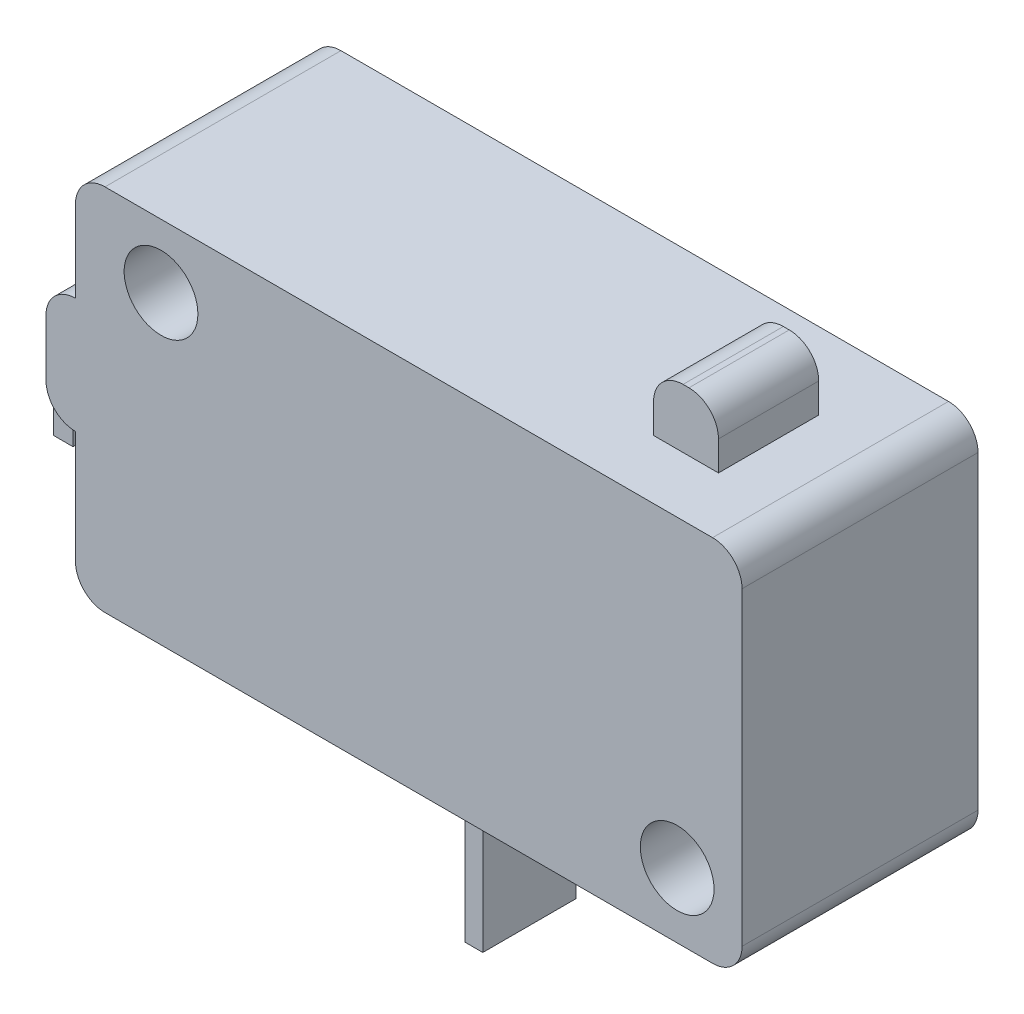
from build123d import *

# Parameters (mm, degrees)
SKETCH1_W           = 28.702
SKETCH1_H           = 15.875
BOSS_EXTRUDE1_DEPTH = 10.16
SKETCH2_R           = 1.5875
CUT_EXTRUDE1_DEPTH  = 12.4206
SKETCH4_W           = 0.763653933
SKETCH4_H           = 4.021910712
BOSS_EXTRUDE2_DEPTH = 6.35
SKETCH5_W           = 4.11779101
SKETCH5_H           = 0.870547728
BOSS_EXTRUDE3_DEPTH = 3.048
SKETCH6_W           = 0.83333033
SKETCH6_H           = 4.11779101
BOSS_EXTRUDE4_DEPTH = 3.048
FILLET1_R           = 0.508
SKETCH7_W           = 10.16
SKETCH7_H           = 4.966371196
BOSS_EXTRUDE5_DEPTH = 1.27
SKETCH8_W           = 2.794
SKETCH8_H           = 4.318
BOSS_EXTRUDE6_DEPTH = 2.54
FILLET3_R           = 1.27
FILLET5_R           = 1.27
FILLET6_R           = 1.27


with BuildPart() as part:
    # Sketch1 → Boss-Extrude1 (new body)
    with BuildSketch(Plane.XY):
        with Locations((14.351, 7.9375)):
            Rectangle(SKETCH1_W, SKETCH1_H)
    extrude(amount=BOSS_EXTRUDE1_DEPTH)

    # Sketch2 → Cut-Extrude1 (cut)
    with BuildSketch(Plane.XY.offset(10.16)):
        with Locations((3.683, 13.1318)):
            Circle(SKETCH2_R)
        with Locations((25.908, 2.794)):
            Circle(SKETCH2_R)
    extrude(amount=-CUT_EXTRUDE1_DEPTH, mode=Mode.SUBTRACT)

    # Sketch4 → Boss-Extrude2 (add)
    with BuildSketch(Plane(origin=(0, 0, 0), x_dir=(-1, 0, 0), z_dir=(0, -1, 0))):
        with Locations((-15.348638273, -6.340278275)):
            Rectangle(SKETCH4_W, SKETCH4_H)
    extrude(amount=BOSS_EXTRUDE2_DEPTH)

    # Sketch5 → Boss-Extrude3 (add)
    with BuildSketch(Plane.ZY):
        with Locations((5.992449892, 6.871421324)):
            Rectangle(SKETCH5_W, SKETCH5_H)
    extrude(amount=BOSS_EXTRUDE3_DEPTH)

    # Sketch6 → Boss-Extrude4 (add)
    with BuildSketch(Plane(origin=(0, 6.43614746, 0), x_dir=(-1, 0, 0), z_dir=(0, -1, 0))):
        with Locations((2.631334835, -5.992449892)):
            Rectangle(SKETCH6_W, SKETCH6_H)
    extrude(amount=BOSS_EXTRUDE4_DEPTH)

    # Fillet1
    fillet1_edges = [part.edges().sort_by_distance(p)[0] for p in [
        (-3.048, 7.306695188, 5.992449892),
    ]]
    fillet(fillet1_edges, radius=FILLET1_R)

    # Sketch7 → Boss-Extrude5 (add)
    with BuildSketch(Plane.ZY):
        with Locations((5.08, 8.603517934)):
            Rectangle(SKETCH7_W, SKETCH7_H)
    extrude(amount=BOSS_EXTRUDE5_DEPTH)

    # Sketch8 → Boss-Extrude6 (add)
    with BuildSketch(Plane(origin=(0, 15.875, 0), x_dir=(1, 0, 0), z_dir=(0, 1, 0))):
        with Locations((23.749, -5.461)):
            Rectangle(SKETCH8_W, SKETCH8_H)
    extrude(amount=BOSS_EXTRUDE6_DEPTH)

    # Fillet3
    fillet3_edges = [part.edges().sort_by_distance(p)[0] for p in [
        (22.352, 18.415, 5.461),
        (25.146, 18.415, 5.461),
    ]]
    fillet(fillet3_edges, radius=FILLET3_R)

    # Fillet5
    fillet5_edges = [part.edges().sort_by_distance(p)[0] for p in [
        (0, 15.875, 5.08),
        (28.702, 15.875, 5.08),
        (28.702, 0, 5.08),
        (0, 0, 5.08),
    ]]
    fillet(fillet5_edges, radius=FILLET5_R)

    # Fillet6
    # the kernel refuses this fillet: 1.27 mm, written as the material it takes off along each edge
    with BuildSketch(Plane(origin=(-1.27, 6.120332336, -3.175), x_dir=(1, 0, 0), z_dir=(0, 0, 1))) as fillet6_piece_1_section:
        with BuildLine():
            CenterArc((FILLET6_R, FILLET6_R), FILLET6_R, 180, 90)
            Line((0, FILLET6_R), (0, 0))
            Line((0, 0), (FILLET6_R, 0))
        make_face()
    fillet6_piece_1 = extrude(amount=16.51, mode=Mode.PRIVATE)
    fillet6_piece_1 = split(fillet6_piece_1, bisect_by=Plane(origin=(-0.894827344, 6.253367253, 3.933554387), z_dir=(0, 0, -1)), keep=Keep.TOP, mode=Mode.PRIVATE)
    add(fillet6_piece_1, mode=Mode.SUBTRACT)
    with BuildSketch(Plane(origin=(-1.27, 6.120332336, -3.175), x_dir=(1, 0, 0), z_dir=(0, 0, 1))) as fillet6_piece_2_section:
        with BuildLine():
            CenterArc((FILLET6_R, FILLET6_R), FILLET6_R, 180, 90)
            Line((0, FILLET6_R), (0, 0))
            Line((0, 0), (FILLET6_R, 0))
        make_face()
    fillet6_piece_2 = extrude(amount=16.51, mode=Mode.PRIVATE)
    fillet6_piece_2 = split(fillet6_piece_2, bisect_by=Plane(origin=(-0.894827344, 6.43614746, 5.992449892), z_dir=(0, -1, 0)), keep=Keep.TOP, mode=Mode.PRIVATE)
    add(fillet6_piece_2, mode=Mode.SUBTRACT)
    with BuildSketch(Plane(origin=(-1.27, 6.120332336, -3.175), x_dir=(1, 0, 0), z_dir=(0, 0, 1))) as fillet6_piece_3_section:
        with BuildLine():
            CenterArc((FILLET6_R, FILLET6_R), FILLET6_R, 180, 90)
            Line((0, FILLET6_R), (0, 0))
            Line((0, 0), (FILLET6_R, 0))
        make_face()
    fillet6_piece_3 = extrude(amount=16.51, mode=Mode.PRIVATE)
    fillet6_piece_3 = split(fillet6_piece_3, bisect_by=Plane(origin=(-1.269173055, 7.306695188, 5.992449892), z_dir=(0, 1, 0)), keep=Keep.TOP, mode=Mode.PRIVATE)
    add(fillet6_piece_3, mode=Mode.SUBTRACT)
    with BuildSketch(Plane(origin=(-1.27, 6.120332336, -3.175), x_dir=(1, 0, 0), z_dir=(0, 0, 1))) as fillet6_piece_4_section:
        with BuildLine():
            CenterArc((FILLET6_R, FILLET6_R), FILLET6_R, 180, 90)
            Line((0, FILLET6_R), (0, 0))
            Line((0, 0), (FILLET6_R, 0))
        make_face()
    fillet6_piece_4 = extrude(amount=16.51, mode=Mode.PRIVATE)
    fillet6_piece_4 = split(fillet6_piece_4, bisect_by=Plane(origin=(-1.145263538, 6.665418953, 8.051345397), z_dir=(0, 0, 1)), keep=Keep.TOP, mode=Mode.PRIVATE)
    add(fillet6_piece_4, mode=Mode.SUBTRACT)
    with BuildSketch(Plane(origin=(-1.27, 11.086703532, 13.335), x_dir=(0, -1, 0), z_dir=(0, 0, -1))) as fillet6_piece_5:
        with BuildLine():
            CenterArc((FILLET6_R, -FILLET6_R), FILLET6_R, 90, 90)
            Line((0, -FILLET6_R), (0, 0))
            Line((0, 0), (FILLET6_R, 0))
        make_face()
    extrude(amount=16.51, mode=Mode.SUBTRACT)


solid = part.part
